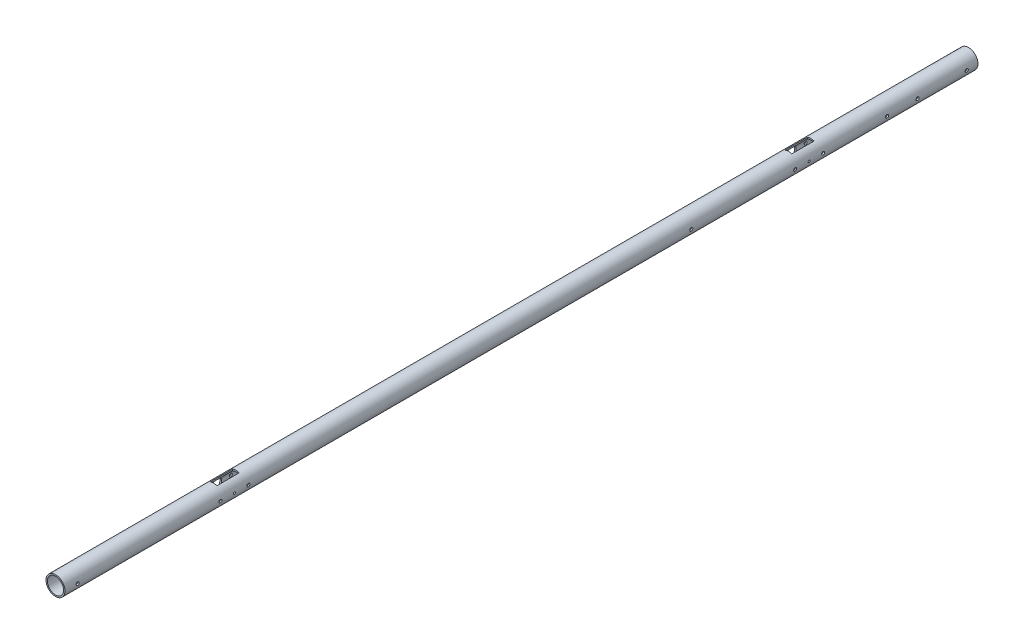
from build123d import *

# Parameters (mm, degrees)
SKETCH1_R                = 9.36
SKETCH1_R_2              = 7.99
EXTRUDE1_DEPTH           = 900
SKETCH4_R                = 1
SKETCH4_R_2              = 1.5
CUT_EXTRUDE3_DEPTH       = 901.097338736
SKETCH5_R                = 4.5
CUT_EXTRUDE6_DEPTH       = 901.097338838
SKETCH6_W                = 6.675
SKETCH6_H                = 22
CUT_EXTRUDE7_DEPTH       = 901.097338838
SKETCH7_W                = 6.675
SKETCH7_H                = 16
CUT_EXTRUDE8_DEPTH       = 901.097338838
CUT_EXTRUDE9_DEPTH       = 901.097338838
CUT_EXTRUDE9_DEPTH_BACK  = 901.097338838
SKETCH8_R                = 1.5
SKETCH8_R_2              = 1.55
CUT_EXTRUDE10_DEPTH      = 901.097338838
CUT_EXTRUDE10_DEPTH_BACK = 901.097338838
SKETCH9_W                = 6.14
SKETCH9_H                = 33.5


with BuildPart() as part:
    # Sketch1 → Extrude1 (new body)
    with BuildSketch(Plane.XY):
        Circle(SKETCH1_R)
        Circle(SKETCH1_R_2, mode=Mode.SUBTRACT)
    extrude(amount=EXTRUDE1_DEPTH)

    # Sketch4 → Cut-Extrude3 (cut, through all)
    with BuildSketch(Plane(origin=(0, 0, 0), x_dir=(0, 0, -1), z_dir=(1, 0, 0))):
        with Locations((-166.425, 0)):
            Circle(SKETCH4_R)
        with Locations((-733, 0)):
            Circle(SKETCH4_R)
        with Locations((-282.57, 0)):
            Circle(SKETCH4_R_2)
    extrude(amount=CUT_EXTRUDE3_DEPTH, mode=Mode.SUBTRACT)

    # Sketch5 → Cut-Extrude6 (cut, through all)
    with BuildSketch(Plane(origin=(0, 0, 0), x_dir=(0, 0, -1), z_dir=(1, 0, 0))):
        with Locations((-166.425, 0)):
            Circle(SKETCH5_R)
        with Locations((-733, 0)):
            Circle(SKETCH5_R)
    extrude(amount=-CUT_EXTRUDE6_DEPTH, mode=Mode.SUBTRACT)

    # Sketch6 → Cut-Extrude7 (cut, through all)
    with BuildSketch(Plane(origin=(0, 0, 0), x_dir=(1, 0, 0), z_dir=(0, 1, 0))):
        with Locations((-0.1625, -166.425)):
            Rectangle(SKETCH6_W, SKETCH6_H)
        with Locations((-0.1625, -733)):
            Rectangle(SKETCH6_W, SKETCH6_H)
    extrude(amount=CUT_EXTRUDE7_DEPTH, mode=Mode.SUBTRACT)

    # Sketch7 → Cut-Extrude8 (cut, through all)
    with BuildSketch(Plane(origin=(0, 0, 0), x_dir=(1, 0, 0), z_dir=(0, 1, 0))):
        with Locations((-0.1625, -166.425)):
            Rectangle(SKETCH7_W, SKETCH7_H)
        with Locations((-0.1625, -733)):
            Rectangle(SKETCH7_W, SKETCH7_H)
    extrude(amount=-CUT_EXTRUDE8_DEPTH, mode=Mode.SUBTRACT)

    # Sketch8 → Cut-Extrude9 (cut, two sides: drawn at the far end of the back side and taken through both)
    with BuildSketch(Plane(origin=(0, 0, 0), x_dir=(0, 0, -1), z_dir=(1, 0, 0)).offset(-CUT_EXTRUDE9_DEPTH_BACK)):
        with Locations((-152.61375, 0)):
            Circle(SKETCH8_R)
        with Locations((-180.17625, 0)):
            Circle(SKETCH8_R)
        with Locations((-59.48, 0)):
            Circle(SKETCH8_R_2)
        with Locations((-89.64, 0)):
            Circle(SKETCH8_R_2)
        with Locations((-11.11, 0)):
            Circle(SKETCH8_R_2)
        with Locations((-746.75125, 0)):
            Circle(SKETCH8_R)
        with Locations((-719.18875, 0)):
            Circle(SKETCH8_R)
        with Locations((-887.4125, 0)):
            Circle(SKETCH8_R)
    extrude(amount=CUT_EXTRUDE9_DEPTH + CUT_EXTRUDE9_DEPTH_BACK, mode=Mode.SUBTRACT)

    # Sketch9 → Cut-Extrude10 (cut, two sides: drawn at the far end of the back side and taken through both)
    with BuildSketch(Plane(origin=(0, 0, 0), x_dir=(1, 0, 0), z_dir=(0, 1, 0)).offset(-CUT_EXTRUDE10_DEPTH_BACK)):
        with Locations((-9.43, -35.94)):
            Rectangle(SKETCH9_W, SKETCH9_H)
    extrude(amount=CUT_EXTRUDE10_DEPTH + CUT_EXTRUDE10_DEPTH_BACK, mode=Mode.SUBTRACT)


solid = part.part
